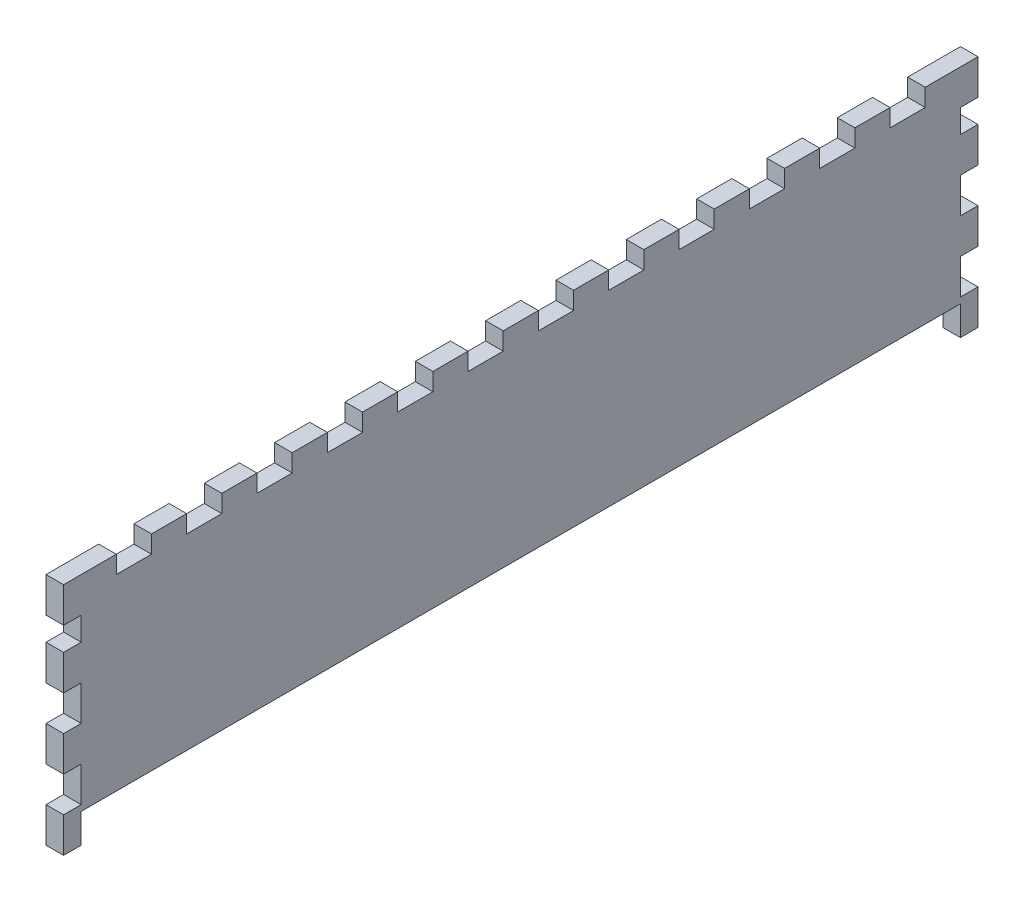
from build123d import *

# Parameters (mm, degrees)
SKETCH1_W               = 150
SKETCH1_H               = 32
BOSS_EXTRUDE1_DEPTH     = 3
SKETCH3_W               = 3
SKETCH3_H               = 6
BOSS_EXTRUDE2_DEPTH     = 3
LPATTERN1_COUNT         = 3
LPATTERN1_PITCH         = 12
LPATTERN1_COL_COUNT     = 2
LPATTERN1_COL_PITCH     = 10
SKETCH4_W               = 3
SKETCH4_H               = 6
BOSS_EXTRUDE3_DEPTH     = 3
LPATTERN2_COUNT         = 7
LPATTERN2_PITCH         = 12
LPATTERN2_COL_COUNT     = 7
LPATTERN2_COL_PITCH     = 12
MIRROR1_COPY_1_SKETCH_W = 3
MIRROR1_COPY_1_SKETCH_H = 6
MIRROR1_COPY_1_DEPTH    = 3
MIRROR1_COPY_2_SKETCH_W = 3
MIRROR1_COPY_2_SKETCH_H = 6
MIRROR1_COPY_2_DEPTH    = 3
MIRROR1_COPY_3_SKETCH_W = 3
MIRROR1_COPY_3_SKETCH_H = 6
MIRROR1_COPY_3_DEPTH    = 3
MIRROR1_COPY_4_SKETCH_W = 3
MIRROR1_COPY_4_SKETCH_H = 6
MIRROR1_COPY_4_DEPTH    = 3


with BuildPart() as part:
    # Sketch1 → Boss-Extrude1 (new body)
    with BuildSketch(Plane(origin=(0, 0, 0), x_dir=(0, 0, -1), z_dir=(1, 0, 0))):
        Rectangle(SKETCH1_W, SKETCH1_H)
    extrude(amount=BOSS_EXTRUDE1_DEPTH)

    # Sketch3 → Boss-Extrude2 (add)
    with BuildSketch(Plane(origin=(0, 0, -75), x_dir=(-1, 0, 0), z_dir=(0, 0, -1))):
        with Locations((-1.5, 6)):
            Rectangle(SKETCH3_W, SKETCH3_H)
    boss_extrude2 = extrude(amount=BOSS_EXTRUDE2_DEPTH)

    # LPattern1: Boss-Extrude2 ×3
    with Locations(*[(0, -i * LPATTERN1_PITCH, 0) for i in range(1, LPATTERN1_COUNT)]):
        add(boss_extrude2)

    # LPattern1 col: Boss-Extrude2 ×2
    with Locations(*[(0, i * LPATTERN1_COL_PITCH, 0) for i in range(1, LPATTERN1_COL_COUNT)]):
        add(boss_extrude2)

    # Sketch4 → Boss-Extrude3 (add)
    with BuildSketch(Plane(origin=(0, 16, 0), x_dir=(1, 0, 0), z_dir=(0, 1, 0))):
        with Locations((1.5, 0)):
            Rectangle(SKETCH4_W, SKETCH4_H)
    boss_extrude3 = extrude(amount=BOSS_EXTRUDE3_DEPTH)

    # LPattern2: Boss-Extrude3 ×7
    with Locations(*[(0, 0, -i * LPATTERN2_PITCH) for i in range(1, LPATTERN2_COUNT)]):
        add(boss_extrude3)

    # LPattern2 col: Boss-Extrude3 ×7
    with Locations(*[(0, 0, i * LPATTERN2_COL_PITCH) for i in range(1, LPATTERN2_COL_COUNT)]):
        add(boss_extrude3)

    # Mirror1 copy 1 sketch → Mirror1 copy 1 (add)
    with BuildSketch(Plane(origin=(0, -12, 75), x_dir=(-1, 0, 0), z_dir=(0, 0, 1))):
        with Locations((-1.5, -6)):
            Rectangle(MIRROR1_COPY_1_SKETCH_W, MIRROR1_COPY_1_SKETCH_H)
    extrude(amount=MIRROR1_COPY_1_DEPTH)

    # Mirror1 copy 2 sketch → Mirror1 copy 2 (add)
    with BuildSketch(Plane(origin=(0, -24, 75), x_dir=(-1, 0, 0), z_dir=(0, 0, 1))):
        with Locations((-1.5, -6)):
            Rectangle(MIRROR1_COPY_2_SKETCH_W, MIRROR1_COPY_2_SKETCH_H)
    extrude(amount=MIRROR1_COPY_2_DEPTH)

    # Mirror1 copy 3 sketch → Mirror1 copy 3 (add)
    with BuildSketch(Plane(origin=(0, 10, 75), x_dir=(-1, 0, 0), z_dir=(0, 0, 1))):
        with Locations((-1.5, -6)):
            Rectangle(MIRROR1_COPY_3_SKETCH_W, MIRROR1_COPY_3_SKETCH_H)
    extrude(amount=MIRROR1_COPY_3_DEPTH)

    # Mirror1 copy 4 sketch → Mirror1 copy 4 (add)
    with BuildSketch(Plane(origin=(0, 0, 75), x_dir=(-1, 0, 0), z_dir=(0, 0, 1))):
        with Locations((-1.5, -6)):
            Rectangle(MIRROR1_COPY_4_SKETCH_W, MIRROR1_COPY_4_SKETCH_H)
    extrude(amount=MIRROR1_COPY_4_DEPTH)


solid = part.part
